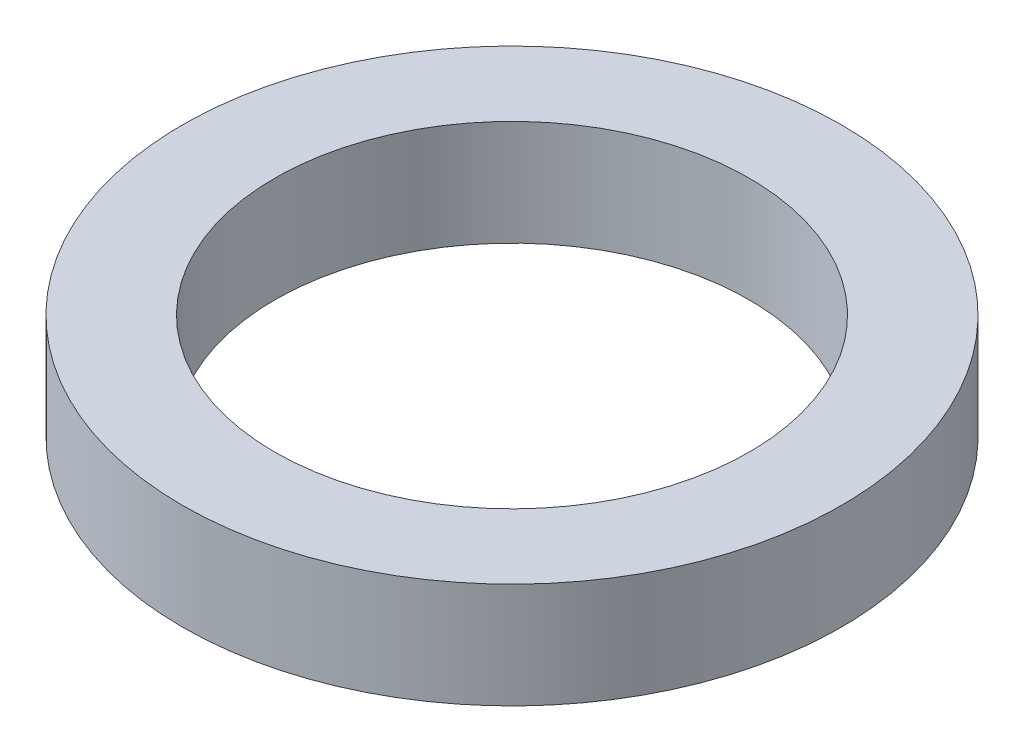
from build123d import *

# Parameters (mm, degrees)
SKETCH1_R           = 62.5
BOSS_EXTRUDE1_DEPTH = 20
SKETCH2_R           = 45
CUT_EXTRUDE1_DEPTH  = 91.622844802


with BuildPart() as part:
    # Sketch1 → Boss-Extrude1 (new body)
    with BuildSketch(Plane(origin=(0, 0, 0), x_dir=(1, 0, 0), z_dir=(0, 1, 0))):
        Circle(SKETCH1_R)
    extrude(amount=BOSS_EXTRUDE1_DEPTH)

    # Sketch2 → Cut-Extrude1 (cut, through all)
    with BuildSketch(Plane(origin=(0, 0, 0), x_dir=(1, 0, 0), z_dir=(0, 1, 0))):
        Circle(SKETCH2_R)
    extrude(amount=CUT_EXTRUDE1_DEPTH, mode=Mode.SUBTRACT)


solid = part.part
